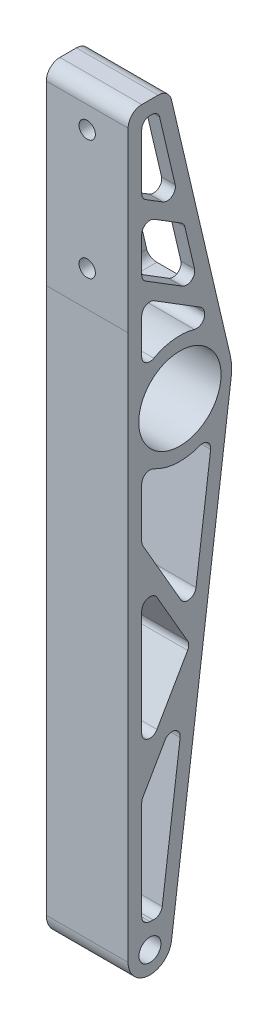
from build123d import *

# Parameters (mm, degrees)
BOSS_EXTRUDE1_DEPTH      = 15
BOSS_EXTRUDE1_DEPTH_BACK = 15
SKETCH1_R                = 4.05
SKETCH1_R_2              = 15.1
CUT_EXTRUDE2_DEPTH       = 10
CUT_EXTRUDE2_DEPTH_BACK  = 10
SKETCH5_W                = 66.834238055
SKETCH5_H                = 69.856255641
CUT_EXTRUDE1_DEPTH       = 274.313007374
CUT_EXTRUDE1_DEPTH_BACK  = 274.313007374
FILLET1_R                = 3
FILLET2_R                = 5
SKETCH6_R                = 3
CUT_EXTRUDE3_DEPTH       = 5


with BuildPart() as part:
    # Sketch1 → Boss-Extrude1 (new, two sides: drawn at the far end of the back side and taken through both)
    with BuildSketch(Plane(origin=(0, 0, 0), x_dir=(0, 0, -1), z_dir=(1, 0, 0)).offset(-BOSS_EXTRUDE1_DEPTH_BACK)):
        with BuildLine():
            Line((-8, 0), (-8, 270))
            Line((-8, 270), (7, 270))
            Line((7, 270), (29.498971947, 173.978261275))
            ThreePointArc((29.498971947, 173.978261275), (29.975942027, 170.599581269), (29.840899654, 167.190073592))
            Line((29.840899654, 167.190073592), (7.933010381, -1.033124533))
            ThreePointArc((7.933010381, -1.033124533), (-0.517647059, -7.983235029), (-8, 0))
        make_face()
        Circle(SKETCH1_R, mode=Mode.SUBTRACT)
        with Locations((11, 169.643744359)):
            Circle(SKETCH1_R_2, mode=Mode.SUBTRACT)
    extrude(amount=BOSS_EXTRUDE1_DEPTH + BOSS_EXTRUDE1_DEPTH_BACK)

    # Sketch5 → Cut-Extrude2 (cut, two sides: drawn at the far end of the back side and taken through both)
    with BuildSketch(Plane(origin=(0, 0, 0), x_dir=(0, 0, -1), z_dir=(1, 0, 0)).offset(-CUT_EXTRUDE2_DEPTH_BACK)):
        with Locations((30.417119028, 230.07187218)):
            Rectangle(SKETCH5_W, SKETCH5_H)
    extrude(amount=CUT_EXTRUDE2_DEPTH + CUT_EXTRUDE2_DEPTH_BACK, mode=Mode.SUBTRACT)

    # Sketch4 → Cut-Extrude1 (cut, two sides: drawn at the far end of the back side and taken through both)
    with BuildSketch(Plane(origin=(15, 0, 0), x_dir=(0, 0, -1), z_dir=(1, 0, 0)).offset(-CUT_EXTRUDE1_DEPTH_BACK)):
        with BuildLine():
            ThreePointArc((23.038271938, 153.672519962), (9.705882353, 149.685656787), (-3, 155.360887501))
            Line((-3, 155.360887501), (-3, 130.360887501))
            Line((-3, 130.360887501), (15.768762187, 97.852437799))
            Line((15.768762187, 97.852437799), (23.038271938, 153.672519962))
        make_face()
        with BuildLine():
            Line((-3, 208.232171682), (-3, 183.926601216))
            ThreePointArc((-3, 183.926601216), (8.703485357, 189.511457375), (21.372438031, 186.743818314))
            Line((21.372438031, 186.743818314), (19.626242772, 194.196279044))
            Line((19.626242772, 194.196279044), (-3, 208.232171682))
        make_face()
        Polygon((14.706143018, 89.692948188), (-3, 120.360887501), (-3, 59.025008875), align=None)
        Polygon((-3, 234.116085841), (-3, 214.116085841), (18.013102612, 201.080883522), (12.529881351, 224.48232784), align=None)
        with BuildLine():
            Line((13.024511965, 76.780277764), (-3, 49.025008875))
            Line((-3, 49.025008875), (-3, 8.485281374))
            ThreePointArc((-3, 8.485281374), (0.582352941, 8.981139407), (4.070672938, 8.026806453))
            Line((4.070672938, 8.026806453), (13.024511965, 76.780277764))
        make_face()
        Polygon((-3, 265), (-3, 240), (10.916741191, 231.366932319), (3.03613565, 265), align=None)
    extrude(amount=CUT_EXTRUDE1_DEPTH + CUT_EXTRUDE1_DEPTH_BACK, mode=Mode.SUBTRACT)

    # Fillet1
    fillet1_edges = [part.edges().sort_by_distance(p)[0] for p in [
        (0, 186.743818314, -21.372438031),
        (0, 183.926601216, 3),
        (0, 194.196279044, -19.626242772),
        (-12.5, 208.232171682, 3),
        (12.5, 224.48232784, -12.529881351),
        (-12.5, 224.48232784, -12.529881351),
        (12.5, 201.080883522, -18.013102612),
        (-12.5, 214.116085841, 3),
        (12.5, 214.116085841, 3),
        (12.5, 208.232171682, 3),
        (-12.5, 234.116085841, 3),
        (12.5, 234.116085841, 3),
        (12.5, 231.366932319, -10.916741191),
        (-12.5, 231.366932319, -10.916741191),
        (12.5, 265, -3.03613565),
        (-12.5, 265, -3.03613565),
        (-12.5, 240, 3),
        (12.5, 240, 3),
        (0, 265, 3),
        (0, 8.026806453, -4.070672938),
        (0, 8.485281374, 3),
        (0, 49.025008875, 3),
        (0, 76.780277764, -13.024511965),
        (0, 59.025008875, 3),
        (0, 89.692948188, -14.706143018),
        (0, 120.360887501, 3),
        (0, 97.852437799, -15.768762187),
        (0, 130.360887501, 3),
        (0, 153.672519962, -23.038271938),
        (0, 155.360887501, 3),
        (-12.5, 201.080883522, -18.013102612),
        (-10, 265, -5.603845906),
        (10, 265, -5.603845906),
        (-10, 195.143744359, -21.319282147),
        (10, 195.143744359, -21.319282147),
    ]]
    fillet(fillet1_edges, radius=FILLET1_R)

    # Fillet2
    fillet2_edges = [part.edges().sort_by_distance(p)[0] for p in [
        (0, 270, 8),
        (0, 270, -7),
    ]]
    fillet(fillet2_edges, radius=FILLET2_R)

    # Sketch6 → Cut-Extrude3 (cut)
    with BuildSketch(Plane.XY.offset(8)):
        with Locations((0, 257)):
            Circle(SKETCH6_R)
        with Locations((0, 213)):
            Circle(SKETCH6_R)
    extrude(amount=-CUT_EXTRUDE3_DEPTH, mode=Mode.SUBTRACT)


solid = part.part
